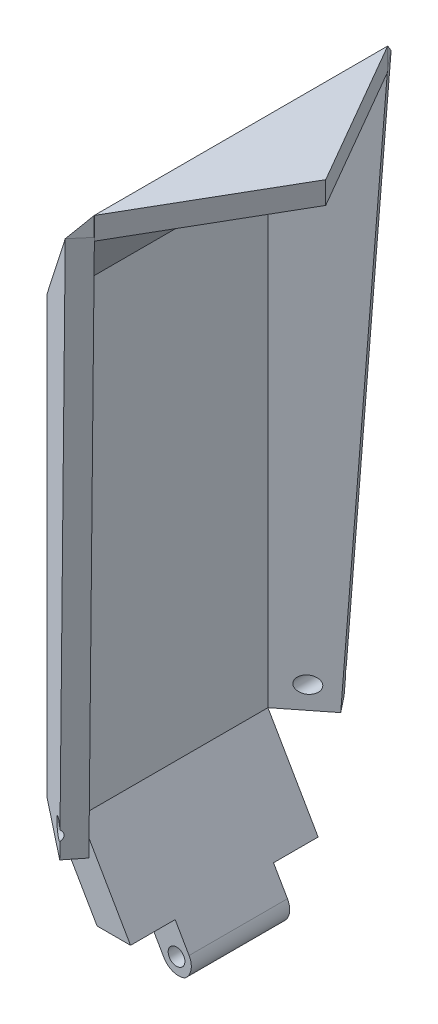
from build123d import *

# Parameters (mm, degrees)
BOSS_EXTRUDE1_DEPTH     = 50
CUT_EXTRUDE1_DEPTH      = 30
BOSS_EXTRUDE2_DEPTH     = 2
CUT_EXTRUDE2_DEPTH      = 2
CUT_EXTRUDE3_DEPTH      = 2
SKETCH9_W               = 3
SKETCH9_H               = 16.82
BOSS_EXTRUDE3_DEPTH     = 13
SKETCH10_W              = 4
SKETCH10_H              = 4
CUT_EXTRUDE4_DEPTH      = 15
BOSS_EXTRUDE4_DEPTH     = 8.82
FILLET1_R               = 1.5
SKETCH12_R              = 0.75
CUT_EXTRUDE5_DEPTH      = 57.090755147
CUT_EXTRUDE7_DEPTH      = 58.56944687
CUT_EXTRUDE7_DEPTH_BACK = 58.56944687
SKETCH15_R              = 0.75
BOSS_EXTRUDE5_DEPTH     = 7.6
CUT_EXTRUDE8_DEPTH      = 3
CUT_EXTRUDE9_DEPTH      = 3
SCALE1_SCALE            = 1.3


with BuildPart() as part:
    # Sketch1 → Boss-Extrude1 (new body)
    with BuildSketch(Plane(origin=(0, 0, 0), x_dir=(1, 0, 0), z_dir=(0, 1, 0))):
        Polygon((0, 0), (0, 16.82), (7.855052448, 23.008549995), (9.003996979, 21.550208451), (3, 16.82), (3, 0), (8.997095559, -4.738955219), (7.846023294, -6.199993425), align=None)
    extrude(amount=BOSS_EXTRUDE1_DEPTH)

    # Sketch2 → Cut-Extrude1 (cut, along a direction that is not the sketch's normal)
    with BuildSketch(Plane(origin=(0, 0, 0), x_dir=(0.7846023293722103, 0, 0.6199993425348946), z_dir=(-0.6199993425348946, 0, 0.7846023293722103))):
        Polygon((11.46, 50), (0, 37), (0, 50), align=None)
    extrude(amount=-CUT_EXTRUDE1_DEPTH, dir=(0, 0, 1), mode=Mode.SUBTRACT)

    # Sketch5 → Boss-Extrude2 (add, along a direction that is not the sketch's normal)
    with BuildSketch(Plane(origin=(-17.310263861, 11.972767428, 0), x_dir=(0, 0, 1), z_dir=(-0.8224425153975565, 0.568848230081223, 0))):
        Polygon((0, 30.43037307), (6.199993425, 44.223196672), (4.746003384, 46.236948917), (-21.566016526, 46.236948917), (-23.008549995, 44.239069366), (-16.82, 30.43037307), align=None)
    extrude(amount=BOSS_EXTRUDE2_DEPTH, dir=(0, 1, 0))

    # Sketch6 → Cut-Extrude2 (cut)
    with BuildSketch(Plane(origin=(0, 0, 0), x_dir=(0.7846023293722103, 0, 0.6199993425348946), z_dir=(-0.6199993425348946, 0, 0.7846023293722103))):
        Polygon((10, 50.343804538), (7, 0), (10, 0), align=None)
    extrude(amount=-CUT_EXTRUDE2_DEPTH, mode=Mode.SUBTRACT)

    # Sketch7 → Cut-Extrude3 (cut)
    with BuildSketch(Plane(origin=(-8.176434921, 0, -10.378250996), x_dir=(-0.7855052448151816, 0, 0.6188549994690533), z_dir=(-0.6188549994690533, 0, -0.7855052448151816))):
        Polygon((-20.409141091, 50.356858917), (-20.409141091, 0), (-17.409141091, 0), align=None)
    extrude(amount=-CUT_EXTRUDE3_DEPTH, mode=Mode.SUBTRACT)

    # Sketch9 → Boss-Extrude3 (add, along a direction that is not the sketch's normal)
    with BuildSketch(Plane.XZ):
        with Locations((1.5, -8.41)):
            Rectangle(SKETCH9_W, SKETCH9_H)
    extrude(amount=BOSS_EXTRUDE3_DEPTH, dir=(0.5000000000000012, -0.866025403784438, 0))

    # Sketch10 → Cut-Extrude4 (cut, along a direction that is not the sketch's normal)
    with BuildSketch(Plane(origin=(0, 0, 0), x_dir=(0, 0, 1), z_dir=(-0.8660254037844379, -0.5000000000000014, 0))):
        with Locations((-14.82, -11)):
            Rectangle(SKETCH10_W, SKETCH10_H)
        with Locations((-2, -11)):
            Rectangle(SKETCH10_W, SKETCH10_H)
    extrude(amount=-CUT_EXTRUDE4_DEPTH, dir=(-1, 0, 0), mode=Mode.SUBTRACT)

    # Sketch11 → Boss-Extrude4 (add)
    with BuildSketch(Plane(origin=(0, 0, -12.82), x_dir=(-1, 0, 0), z_dir=(0, 0, -1))):
        Polygon((-9.5, -11.258330249), (-7.25, -12.557368355), (-6.5, -11.258330249), align=None)
    extrude(amount=-BOSS_EXTRUDE4_DEPTH)

    # Fillet1
    # the kernel refuses this fillet: 1.5 mm, written as the material it takes off along each edge
    with BuildSketch(Plane(origin=(9.5, -11.258330249, -0.25), x_dir=(-0.8660254037844393, -0.49999999999999895, 0), z_dir=(0, 0, -1)), Plane(origin=(7.25, -12.557368355, -16.57), x_dir=(0.8660254037844389, 0.4999999999999996, 0), z_dir=(0, 0, 1))) as fillet1_piece_1:
        with BuildLine():
            CenterArc((FILLET1_R, FILLET1_R), FILLET1_R, 180, 90)
            Line((0, FILLET1_R), (0, 0))
            Line((0, 0), (FILLET1_R, 0))
        make_face()
    extrude(amount=16.32, mode=Mode.SUBTRACT)

    # Sketch12 → Cut-Extrude5 (cut, through all)
    with BuildSketch(Plane.XY.offset(-4)):
        with Locations((7.625, -10.608811196)):
            Circle(SKETCH12_R)
    extrude(amount=-CUT_EXTRUDE5_DEPTH, mode=Mode.SUBTRACT)

    # Sketch15 → Cut-Extrude7 (cut, two sides: drawn at the far end of the back side and taken through both)
    with BuildSketch(Plane.XY.offset(-CUT_EXTRUDE7_DEPTH_BACK)):
        with Locations(Location((5, 2, 0), (0, 0, 35.261867611))):
            Circle(SKETCH15_R)
    extrude(amount=CUT_EXTRUDE7_DEPTH + CUT_EXTRUDE7_DEPTH_BACK, mode=Mode.SUBTRACT)

    # Sketch17 → Boss-Extrude5 (add)
    with BuildSketch(Plane(origin=(8.991542695, 0, 0), x_dir=(0, 0, -1), z_dir=(1, 0, 0))):
        Polygon((-4.746003384, 52), (-4.717307032, 50), (21.531663082, 50), (21.566016526, 52), align=None)
    extrude(amount=BOSS_EXTRUDE5_DEPTH)

    # Sketch18 → Cut-Extrude8 (cut)
    with BuildSketch(Plane(origin=(0, 52, 0), x_dir=(1, 0, 0), z_dir=(0, 1, 0))):
        Polygon((8.991542695, 21.566016526), (16.591542695, 8.410006571), (16.591542695, 21.566016526), align=None)
    extrude(amount=-CUT_EXTRUDE8_DEPTH, mode=Mode.SUBTRACT)

    # Sketch19 → Cut-Extrude9 (cut)
    with BuildSketch(Plane(origin=(0, 52, 0), x_dir=(1, 0, 0), z_dir=(0, 1, 0))):
        Polygon((16.591542695, 8.410006571), (8.991542695, -4.746003384), (16.591542695, -4.746003384), align=None)
    extrude(amount=-CUT_EXTRUDE9_DEPTH, mode=Mode.SUBTRACT)


with BuildPart() as part_1:
    # Scale1: scaled about (3.445853057, 21.968382551, -8.406041901)
    add(part.part.scale(SCALE1_SCALE).moved(Location((-1.033755917, -6.590514765, 2.52181257))))


solid = part_1.part
